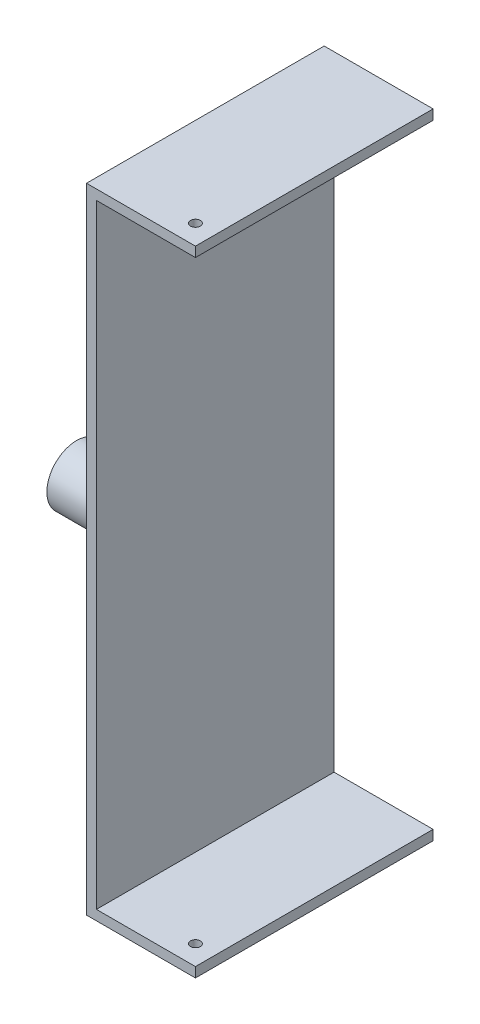
from build123d import *

# Parameters (mm, degrees)
BOSS_EXTRUDE1_DEPTH = 120
SKETCH2_R           = 15
BOSS_EXTRUDE2_DEPTH = 35
SKETCH3_R           = 2.5
CUT_EXTRUDE1_DEPTH  = 320


with BuildPart() as part:
    # Sketch1 → Boss-Extrude1 (new body)
    with BuildSketch(Plane.XY):
        Polygon((-5, 5), (50, 5), (50, 0), (0, 0), (0, -310), (50, -310), (50, -315), (-5, -315), align=None)
    extrude(amount=BOSS_EXTRUDE1_DEPTH)

    # Sketch2 → Boss-Extrude2 (add)
    with BuildSketch(Plane.ZY.offset(5)):
        with Locations((90, -155)):
            Circle(SKETCH2_R)
    extrude(amount=BOSS_EXTRUDE2_DEPTH)

    # Sketch3 → Cut-Extrude1 (cut)
    with BuildSketch(Plane.XZ.offset(315)):
        with Locations((40, 110)):
            Circle(SKETCH3_R)
    extrude(amount=-CUT_EXTRUDE1_DEPTH, mode=Mode.SUBTRACT)


solid = part.part
